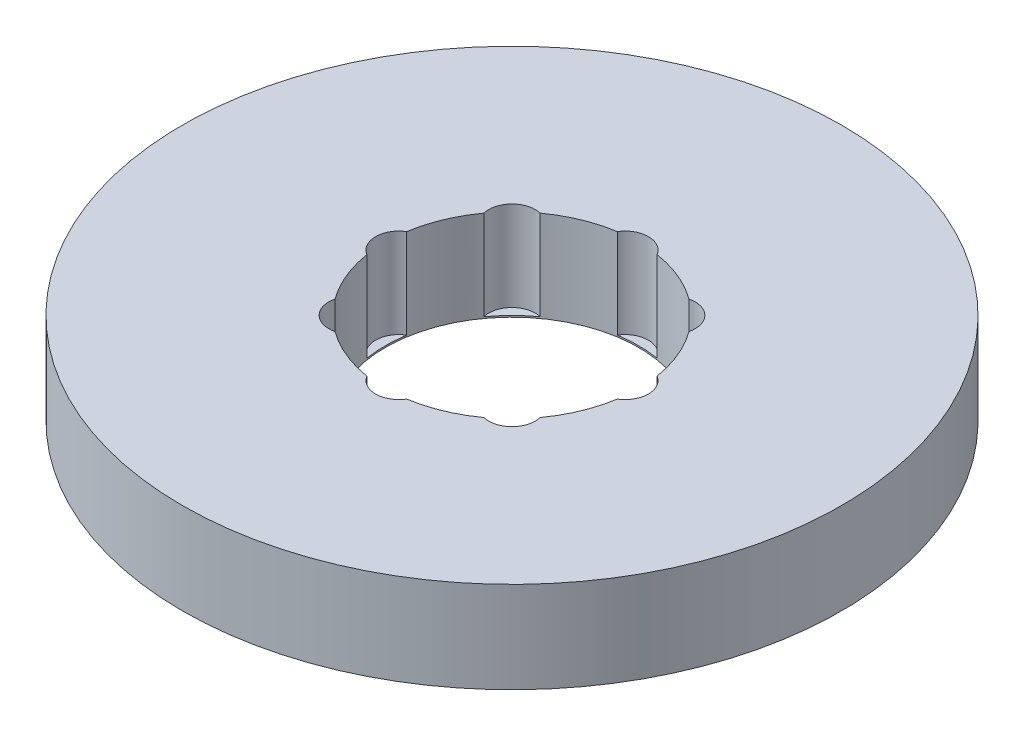
from build123d import *

# Parameters (mm, degrees)
SKETCH1_R           = 32.5
BOSS_EXTRUDE1_DEPTH = 9
SKETCH2_R           = 12.5
CUT_EXTRUDE1_DEPTH  = 47.834816109
SKETCH3_R           = 2.293323558
CUT_EXTRUDE2_DEPTH  = 8.845206288
CIRPATTERN1_COUNT   = 8


with BuildPart() as part:
    # Sketch1 → Boss-Extrude1 (new body)
    with BuildSketch(Plane(origin=(0, 0, 0), x_dir=(1, 0, 0), z_dir=(0, 1, 0))):
        Circle(SKETCH1_R)
    extrude(amount=BOSS_EXTRUDE1_DEPTH)

    # Sketch2 → Cut-Extrude1 (cut, through all)
    with BuildSketch(Plane(origin=(0, 0, 0), x_dir=(1, 0, 0), z_dir=(0, 1, 0))):
        Circle(SKETCH2_R)
    extrude(amount=CUT_EXTRUDE1_DEPTH, mode=Mode.SUBTRACT)

    # Sketch3 → Cut-Extrude2 (cut)
    with BuildSketch(Plane(origin=(0, 9, 0), x_dir=(1, 0, 0), z_dir=(0, 1, 0))):
        with Locations((-11.154965368, 0)):
            Circle(SKETCH3_R)
    cut_extrude2 = extrude(amount=-CUT_EXTRUDE2_DEPTH, mode=Mode.SUBTRACT)

    # CirPattern1: Cut-Extrude2 ×8 about axis
    cirpattern1_axis = Axis((0, 0, 0), (0, 1, 0))
    for i in range(1, CIRPATTERN1_COUNT):
        add(cut_extrude2.rotate(cirpattern1_axis, i * 360 / CIRPATTERN1_COUNT), mode=Mode.SUBTRACT)


solid = part.part
